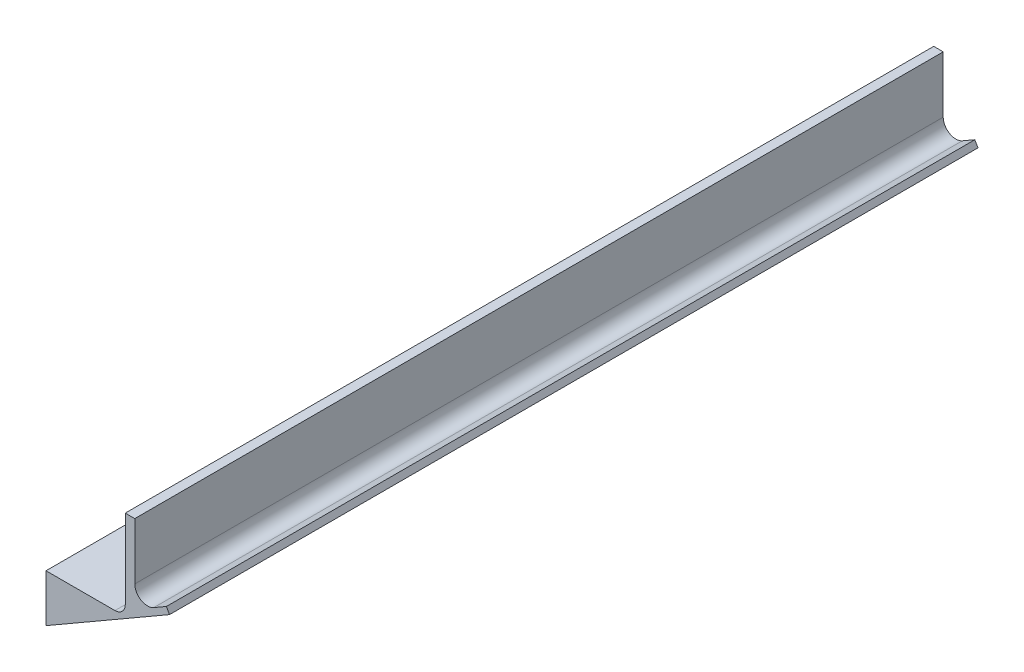
from build123d import *

# Parameters (mm, degrees)
SALIENTE_EXTRUIR1_DEPTH = 255
CROQUIS4_W              = 1.329700855
CROQUIS4_H              = 7.408333333
CROQUIS4_W_2            = 1.329700854
CORTAR_EXTRUIR1_DEPTH   = 1
CROQUIS3_R              = 3.25
CORTAR_EXTRUIR2_DEPTH   = 4


with BuildPart() as part:
    # Croquis2 → Saliente-Extruir1 (new body)
    with BuildSketch(Plane.XY):
        with BuildLine():
            Line((0, 0), (21.75, 0))
            ThreePointArc((21.75, 0), (24.048097039, 0.951902961), (25, 3.25))
            Line((25, 3.25), (25, 28.25))
            Line((25, 28.25), (28, 28.25))
            Line((28, 28.25), (28, 10.403411844))
            ThreePointArc((28, 10.403411844), (30, 6.939310229), (34, 6.939310229))
            Line((34, 6.939310229), (37.97114317, 9.232050808))
            Line((37.97114317, 9.232050808), (38.97114317, 7.5))
            Line((38.97114317, 7.5), (0, -15))
            Line((0, -15), (0, 0))
        make_face()
    extrude(amount=SALIENTE_EXTRUIR1_DEPTH)

    # Croquis4 → Cortar-Extruir1 (cut)
    # profile 1 of 10: a face of its own
    with BuildSketch(Plane.ZY):
        with BuildLine():
            Line((100.85849359, -8), (100.85849359, -0.591666667))
            Line((100.85849359, -0.591666667), (102.045726496, -0.591666667))
            add(Edge.make_bspline(
                [(102.045726496, -0.591666667), (102.128840223, -0.591657181), (102.289663708, -0.591638827), (102.521690027, -0.59978683), (102.736874843, -0.610327184), (102.934533353, -0.622119389), (103.115001988, -0.642439715), (103.278006314, -0.663855118), (103.423872015, -0.689680775), (103.514052852, -0.712847189), (103.556480369, -0.723746327)],
                knots=[0, 0, 0, 0, 1.311965854, 2.538629056, 3.664479157, 4.713267157, 5.663616078, 6.530575999, 7.308677837, 8, 8, 8, 8], degree=3))
            add(Edge.make_bspline(
                [(103.556480369, -0.723746327), (103.612192006, -0.739119756), (103.721516122, -0.769287359), (103.878103145, -0.830212136), (104.026647779, -0.897934346), (104.166968655, -0.975192721), (104.298204147, -1.062919987), (104.419855516, -1.161812373), (104.534546479, -1.267900344), (104.638204624, -1.38414054), (104.731894509, -1.50696984), (104.81329422, -1.636356059), (104.884020136, -1.770320797), (104.940619395, -1.910549911), (104.983265873, -2.056397608), (105.014457329, -2.207241096), (105.034673616, -2.363557681), (105.03658379, -2.469904963), (105.037553419, -2.523888221)],
                knots=[0, 0, 0, 0, 1.099996261, 2.158545794, 3.195537121, 4.207578794, 5.205712374, 6.197378256, 7.190519799, 8.17788031, 9.159561366, 10.129234751, 11.085776129, 12.040971148, 13.00380137, 13.975669004, 14.972423361, 16, 16, 16, 16], degree=3))
            add(Edge.make_bspline(
                [(105.037553419, -2.523888221), (105.035018127, -2.593242538), (105.030027716, -2.729757989), (104.998148633, -2.930274489), (104.938370385, -3.119791401), (104.860152002, -3.301801453), (104.753799454, -3.475625744), (104.618752288, -3.641181627), (104.457197825, -3.803566814), (104.333276633, -3.900905781), (104.268820112, -3.951535791)],
                knots=[0, 0, 0, 0, 0.986156485, 1.941127874, 2.875419072, 3.804401753, 4.751181392, 5.761612777, 6.835722519, 8, 8, 8, 8], degree=3))
            add(Edge.make_bspline(
                [(104.268820112, -3.951535791), (104.321052585, -3.978200015), (104.423466012, -4.030481181), (104.568862991, -4.116415812), (104.703484723, -4.207818191), (104.82793481, -4.302849265), (104.939602769, -4.405537539), (105.043099558, -4.509965974), (105.133319182, -4.622117885), (105.213996289, -4.737995964), (105.28411952, -4.859278139), (105.345189121, -4.985759592), (105.396772422, -5.117872411), (105.440454496, -5.254944249), (105.473032598, -5.397446568), (105.494274213, -5.545430335), (105.510538122, -5.698390847), (105.511803301, -5.802583729), (105.512446581, -5.855560564)],
                knots=[0, 0, 0, 0, 1.164658916, 2.283573913, 3.35186032, 4.395461096, 5.390182219, 6.362969632, 7.312859996, 8.245001507, 9.165155236, 10.092416118, 11.032087915, 11.979892451, 12.947605196, 13.931445124, 14.948243989, 16, 16, 16, 16], degree=3))
            add(Edge.make_bspline(
                [(105.512446581, -5.855560564), (105.508272124, -5.956743289), (105.50003385, -6.156426991), (105.439799611, -6.449608526), (105.33537258, -6.727571212), (105.195148611, -6.989210308), (105.022365701, -7.226951791), (104.823714904, -7.435211265), (104.601196177, -7.611498287), (104.395895756, -7.730478351), (104.218327059, -7.8103251), (104.071250226, -7.859691396), (103.913292824, -7.905424257), (103.741561454, -7.937538817), (103.55916937, -7.966933593), (103.36433824, -7.985082537), (103.157432198, -7.997381629), (103.015320185, -7.999109564), (102.94208734, -8)],
                knots=[0, 0, 0, 0, 1.284142165, 2.534249414, 3.780121997, 5.041676246, 6.291546858, 7.49970053, 8.684500223, 9.883330709, 10.50184324, 11.153274765, 11.851151195, 12.587658647, 13.369265475, 14.195992086, 15.070362669, 16, 16, 16, 16], degree=3))
            Line((102.94208734, -8), (100.85849359, -8))
        make_face()
        with BuildLine():
            Line((102.188194444, -1.921367521), (102.188194444, -3.536004274))
            Line((102.188194444, -3.536004274), (102.541396234, -3.536004274))
            add(Edge.make_bspline(
                [(102.541396234, -3.536004274), (102.589399531, -3.535585667), (102.682066989, -3.534777571), (102.815915304, -3.524369584), (102.940372622, -3.506612912), (103.054966901, -3.481837888), (103.160765631, -3.450377219), (103.257092937, -3.412523259), (103.343525287, -3.366337313), (103.443939687, -3.297541309), (103.550084949, -3.196304908), (103.643523429, -3.050047952), (103.69855807, -2.88185301), (103.704687444, -2.763228913), (103.707852564, -2.701973157)],
                knots=[0, 0, 0, 0, 1.065314748, 2.056525647, 2.977365736, 3.853934255, 4.656397591, 5.425096493, 6.14721249, 6.826394842, 8.123232004, 9.372140726, 10.643011755, 12, 12, 12, 12], degree=3))
            add(Edge.make_bspline(
                [(103.707852564, -2.701973157), (103.705319889, -2.644596964), (103.700423063, -2.533662402), (103.645010256, -2.377900396), (103.558943211, -2.23986338), (103.457328967, -2.145388332), (103.361639411, -2.080864659), (103.279704142, -2.038378568), (103.189774031, -2.000345453), (103.090108128, -1.971264407), (102.98127558, -1.949443014), (102.863805048, -1.933417814), (102.737493853, -1.922510381), (102.650250443, -1.921756646), (102.605210003, -1.921367521)],
                knots=[0, 0, 0, 0, 1.347982417, 2.606269829, 3.849316587, 5.153353503, 5.842674298, 6.568177932, 7.326619318, 8.142485038, 9.012069166, 9.942760135, 10.937925643, 12, 12, 12, 12], degree=3))
            Line((102.605210003, -1.921367521), (102.188194444, -1.921367521))
        make_face(mode=Mode.SUBTRACT)
        with BuildLine():
            Line((102.188194444, -4.770726496), (102.188194444, -6.670299145))
            Line((102.188194444, -6.670299145), (102.571077057, -6.670299145))
            add(Edge.make_bspline(
                [(102.571077057, -6.670299145), (102.646773437, -6.669866695), (102.792309173, -6.669035254), (103.000788857, -6.658989479), (103.19034901, -6.640883739), (103.360487368, -6.618280181), (103.511464532, -6.587655895), (103.642770161, -6.54872104), (103.756204943, -6.505885918), (103.851088717, -6.452979457), (103.928603325, -6.391409456), (103.998552131, -6.328483436), (104.055584029, -6.255892327), (104.100708731, -6.176752263), (104.139764081, -6.093029143), (104.16331951, -6.001453606), (104.181253787, -5.904739734), (104.182240758, -5.83784484), (104.182745726, -5.803619124)],
                knots=[0, 0, 0, 0, 1.753078804, 3.370512758, 4.83203934, 6.162291463, 7.344201807, 8.395507345, 9.331626367, 10.147333109, 10.898971645, 11.62040215, 12.321813352, 13.025280112, 13.727906689, 14.453419512, 15.208716525, 16, 16, 16, 16], degree=3))
            add(Edge.make_bspline(
                [(104.182745726, -5.803619124), (104.181632127, -5.76448148), (104.179463133, -5.688251877), (104.161748941, -5.576834177), (104.129556466, -5.472818362), (104.089008472, -5.373544607), (104.032583786, -5.282567258), (103.965524974, -5.196737933), (103.88450081, -5.118963079), (103.793384411, -5.044538582), (103.687106153, -4.979375903), (103.565616173, -4.922835737), (103.428254471, -4.875615472), (103.274595554, -4.838018666), (103.105313053, -4.806110777), (102.919171389, -4.787058244), (102.717720816, -4.772888039), (102.578031711, -4.771463382), (102.505779247, -4.770726496)],
                knots=[0, 0, 0, 0, 0.845221588, 1.646264278, 2.427170338, 3.19324141, 3.95557735, 4.731569926, 5.540061037, 6.376114724, 7.268642756, 8.224665384, 9.265483498, 10.400594375, 11.639216012, 12.983232105, 14.439614077, 16, 16, 16, 16], degree=3))
            Line((102.505779247, -4.770726496), (102.188194444, -4.770726496))
        make_face(mode=Mode.SUBTRACT)
    # profile 2 of 10: a face of its own
    with BuildSketch(Plane.ZY):
        with Locations((107.317040599, -4.295833334)):
            Rectangle(CROQUIS4_W, CROQUIS4_H)
    # profile 3 of 10: a face of its own
    with BuildSketch(Plane.ZY):
        with BuildLine():
            add(Edge.make_bspline(
                [(113.173066907, -0.401709402), (113.301869861, -0.405044341), (113.556156067, -0.411628266), (113.930119312, -0.466510421), (114.290502045, -0.555933025), (114.637141301, -0.680236913), (114.969169134, -0.842788864), (115.28775672, -1.038980426), (115.591762891, -1.272514595), (115.878072437, -1.537943406), (116.142674094, -1.826585648), (116.371951585, -2.137360338), (116.567471018, -2.462214992), (116.729518047, -2.802020066), (116.852947021, -3.159128874), (116.939562238, -3.531720633), (116.995208223, -3.919689343), (117.001608368, -4.183843154), (117.004861111, -4.31809395)],
                knots=[0, 0, 0, 0, 1.014329547, 2.002516266, 2.970391464, 3.935626869, 4.897733899, 5.877609409, 6.878433252, 7.912639331, 8.949961323, 9.958554974, 10.949718813, 11.932905612, 12.9188844, 13.919928257, 14.942845884, 16, 16, 16, 16], degree=3))
            add(Edge.make_bspline(
                [(117.004861111, -4.31809395), (117.00139708, -4.450832051), (116.994571097, -4.712396736), (116.941833951, -5.096790161), (116.853760123, -5.465390686), (116.732424601, -5.819032645), (116.573316492, -6.156003118), (116.381609901, -6.478453615), (116.152246055, -6.783391718), (115.893590755, -7.070653786), (115.608833716, -7.331405752), (115.307230808, -7.561192972), (114.990174645, -7.755905991), (114.658129297, -7.91545562), (114.31038271, -8.039276211), (113.947793858, -8.126640636), (113.57038518, -8.17973376), (113.313728976, -8.186515157), (113.183455195, -8.189957265)],
                knots=[0, 0, 0, 0, 1.051557043, 2.072126891, 3.067553643, 4.050577992, 5.02905126, 6.015227836, 7.017913613, 8.04756643, 9.074058332, 10.072836633, 11.047628519, 12.017157415, 12.98668631, 13.966869689, 14.968021931, 16, 16, 16, 16], degree=3))
            add(Edge.make_bspline(
                [(113.183455195, -8.189957265), (113.04720444, -8.186869525), (112.779490331, -8.180802538), (112.387689534, -8.12310826), (112.012310516, -8.036200522), (111.656506677, -7.906495387), (111.316654459, -7.744353061), (110.995250856, -7.544665066), (110.69240388, -7.307761401), (110.409850712, -7.039709257), (110.153856858, -6.746401419), (109.927892068, -6.436547699), (109.737285755, -6.112515106), (109.582030946, -5.774151986), (109.45963429, -5.423561183), (109.373297357, -5.058607499), (109.32229607, -4.680166225), (109.315191887, -4.423121347), (109.31159188, -4.292865251)],
                knots=[0, 0, 0, 0, 1.067978421, 2.098431617, 3.099715153, 4.085208694, 5.062210972, 6.048429807, 7.046490867, 8.072918869, 9.098532598, 10.095778865, 11.076610158, 12.041847152, 13.011192615, 13.984257998, 14.978533688, 16, 16, 16, 16], degree=3))
            add(Edge.make_bspline(
                [(109.31159188, -4.292865251), (109.31272177, -4.205235769), (109.314967241, -4.031086394), (109.342016313, -3.77300591), (109.3809592, -3.519962811), (109.438553881, -3.272965982), (109.508516699, -3.030272977), (109.599163412, -2.794142842), (109.702343903, -2.562053058), (109.822900591, -2.336744895), (109.956947972, -2.120291377), (110.103205599, -1.913713554), (110.262041235, -1.719509252), (110.432943218, -1.536402241), (110.616500499, -1.365596098), (110.810298572, -1.204672822), (111.018095991, -1.057907109), (111.235344722, -0.921714647), (111.460819968, -0.798558166), (111.693603838, -0.693731052), (111.928900527, -0.60218732), (112.169853279, -0.529936958), (112.413879859, -0.471089794), (112.663587195, -0.432173155), (112.916719323, -0.405124832), (113.087414924, -0.40285058), (113.173066907, -0.401709402)],
                knots=[0, 0, 0, 0, 1.034744296, 2.056386356, 3.06226378, 4.057406941, 5.050368692, 6.043467995, 7.042652155, 8.049140477, 9.059438543, 10.048523776, 11.036952808, 12.020949711, 13.004946614, 13.997082645, 14.994316842, 16.007702937, 17.024872941, 18.026463647, 19.021641123, 20.005082605, 20.995858141, 21.984425357, 22.988620895, 24, 24, 24, 24], degree=3))
        make_face()
        with BuildLine():
            add(Edge.make_bspline(
                [(113.152290331, -1.731410256), (113.06560596, -1.733736193), (112.894525699, -1.73832666), (112.643582113, -1.773299814), (112.402667408, -1.829155916), (112.17311707, -1.910062797), (111.953936207, -2.013036722), (111.744736281, -2.137717888), (111.548414277, -2.28839207), (111.362352431, -2.456970244), (111.19427617, -2.644805071), (111.045775491, -2.846102034), (110.921504342, -3.060524968), (110.817426476, -3.286081936), (110.73907891, -3.525309267), (110.683274287, -3.776333066), (110.648007849, -4.03958586), (110.643562471, -4.219044948), (110.641292735, -4.310673745)],
                knots=[0, 0, 0, 0, 1.033739768, 2.040188636, 3.016340934, 3.979330865, 4.937572243, 5.900995986, 6.878200029, 7.884839167, 8.891893314, 9.879764717, 10.863503415, 11.843163062, 12.837761627, 13.859916423, 14.907309254, 16, 16, 16, 16], degree=3))
            add(Edge.make_bspline(
                [(110.641292735, -4.310673745), (110.644302058, -4.412219063), (110.650199832, -4.611231063), (110.691697288, -4.901544406), (110.762695305, -5.175716545), (110.86521506, -5.432406545), (110.992366453, -5.674464756), (111.150268304, -5.898924411), (111.336363348, -6.107129469), (111.479729463, -6.228688254), (111.55249399, -6.290384615)],
                knots=[0, 0, 0, 0, 1.078454662, 2.113592447, 3.107694534, 4.079536787, 5.043276885, 6.005368276, 6.987637804, 8, 8, 8, 8], degree=3))
            add(Edge.make_bspline(
                [(111.55249399, -6.290384615), (111.61210203, -6.335963517), (111.72997513, -6.42609442), (111.91812626, -6.541615663), (112.111884876, -6.640628892), (112.312713128, -6.720630409), (112.520186879, -6.783558258), (112.734277676, -6.827625596), (112.954682172, -6.855281661), (113.103730021, -6.858587085), (113.179003072, -6.86025641)],
                knots=[0, 0, 0, 0, 1.023928204, 2.024787132, 3.009472467, 3.9914905, 4.972207045, 5.96565515, 6.972602802, 8, 8, 8, 8], degree=3))
            add(Edge.make_bspline(
                [(113.179003072, -6.86025641), (113.264196903, -6.857910753), (113.431818446, -6.853295597), (113.678090581, -6.818752982), (113.914026768, -6.760294406), (114.141091716, -6.680097269), (114.358630672, -6.575830417), (114.565580464, -6.447282032), (114.762303932, -6.296030524), (114.948128737, -6.125238549), (115.117981393, -5.936663782), (115.266172182, -5.734293123), (115.394394533, -5.522585402), (115.496308098, -5.298544219), (115.577751, -5.064284416), (115.632883984, -4.818768507), (115.668448344, -4.563008603), (115.672894975, -4.38895495), (115.675160256, -4.300285457)],
                knots=[0, 0, 0, 0, 1.026359118, 2.019393844, 2.989460624, 3.950973911, 4.916101784, 5.890408035, 6.881132271, 7.902007068, 8.92769091, 9.933912415, 10.920395702, 11.90457117, 12.894218921, 13.903490204, 14.931958862, 16, 16, 16, 16], degree=3))
            add(Edge.make_bspline(
                [(115.675160256, -4.300285457), (115.672816596, -4.212125837), (115.668203458, -4.038597072), (115.633600046, -3.783494725), (115.575512198, -3.539062697), (115.495074238, -3.304901805), (115.392359222, -3.080782485), (115.265341684, -2.867492873), (115.114467313, -2.665239167), (114.943208474, -2.475399649), (114.756803754, -2.300949292), (114.556679661, -2.149558094), (114.348435893, -2.018003957), (114.127294321, -1.914949757), (113.897779317, -1.832846696), (113.658490368, -1.772384823), (113.408521152, -1.738572348), (113.238461927, -1.733818901), (113.152290331, -1.731410256)],
                knots=[0, 0, 0, 0, 1.055025985, 2.07665775, 3.074803781, 4.057872707, 5.035505728, 6.020516407, 7.023567878, 8.050795229, 9.077271434, 10.074415901, 11.050397877, 12.019801805, 12.988065821, 13.964604439, 14.968634123, 16, 16, 16, 16], degree=3))
        make_face(mode=Mode.SUBTRACT)
    # profile 4 of 10: a face of its own
    with BuildSketch(Plane.ZY):
        with BuildLine():
            Line((118.334561966, -8), (118.334561966, -0.591666667))
            Line((118.334561966, -0.591666667), (119.521794872, -0.591666667))
            add(Edge.make_bspline(
                [(119.521794872, -0.591666667), (119.604908599, -0.591657181), (119.765732084, -0.591638827), (119.997758403, -0.59978683), (120.212943219, -0.610327184), (120.410601729, -0.622119389), (120.591070364, -0.642439715), (120.75407469, -0.663855118), (120.899940391, -0.689680775), (120.990121228, -0.712847189), (121.032548745, -0.723746327)],
                knots=[0, 0, 0, 0, 1.311965854, 2.538629056, 3.664479157, 4.713267157, 5.663616078, 6.530575999, 7.308677837, 8, 8, 8, 8], degree=3))
            add(Edge.make_bspline(
                [(121.032548745, -0.723746327), (121.088260382, -0.739119756), (121.197584498, -0.769287359), (121.354171521, -0.830212136), (121.502716155, -0.897934346), (121.643037031, -0.975192721), (121.774272523, -1.062919987), (121.895923892, -1.161812373), (122.010614856, -1.267900344), (122.114273001, -1.38414054), (122.207962885, -1.50696984), (122.289362596, -1.636356059), (122.360088512, -1.770320797), (122.416687771, -1.910549911), (122.459334249, -2.056397608), (122.490525705, -2.207241096), (122.510741992, -2.363557681), (122.512652166, -2.469904963), (122.513621795, -2.523888221)],
                knots=[0, 0, 0, 0, 1.099996261, 2.158545794, 3.195537121, 4.207578794, 5.205712374, 6.197378256, 7.190519799, 8.17788031, 9.159561366, 10.129234751, 11.085776129, 12.040971148, 13.00380137, 13.975669004, 14.972423361, 16, 16, 16, 16], degree=3))
            add(Edge.make_bspline(
                [(122.513621795, -2.523888221), (122.511086503, -2.593242538), (122.506096092, -2.729757989), (122.474217009, -2.930274489), (122.414438761, -3.119791401), (122.336220378, -3.301801453), (122.22986783, -3.475625744), (122.094820664, -3.641181627), (121.933266201, -3.803566814), (121.809345009, -3.900905781), (121.744888488, -3.951535791)],
                knots=[0, 0, 0, 0, 0.986156485, 1.941127874, 2.875419072, 3.804401753, 4.751181392, 5.761612777, 6.835722519, 8, 8, 8, 8], degree=3))
            add(Edge.make_bspline(
                [(121.744888488, -3.951535791), (121.797120961, -3.978200015), (121.899534388, -4.030481181), (122.044931367, -4.116415812), (122.179553099, -4.207818191), (122.304003186, -4.302849265), (122.415671145, -4.405537539), (122.519167934, -4.509965974), (122.609387558, -4.622117885), (122.690064665, -4.737995964), (122.760187896, -4.859278139), (122.821257497, -4.985759592), (122.872840798, -5.117872411), (122.916522872, -5.254944249), (122.949100974, -5.397446568), (122.97034259, -5.545430335), (122.986606498, -5.698390847), (122.987871677, -5.802583729), (122.988514957, -5.855560564)],
                knots=[0, 0, 0, 0, 1.164658916, 2.283573913, 3.35186032, 4.395461096, 5.390182219, 6.362969632, 7.312859996, 8.245001507, 9.165155236, 10.092416118, 11.032087915, 11.979892451, 12.947605196, 13.931445124, 14.948243989, 16, 16, 16, 16], degree=3))
            add(Edge.make_bspline(
                [(122.988514957, -5.855560564), (122.9843405, -5.956743289), (122.976102226, -6.156426991), (122.915867987, -6.449608526), (122.811440956, -6.727571212), (122.671216987, -6.989210308), (122.498434078, -7.226951791), (122.29978328, -7.435211265), (122.077264553, -7.611498287), (121.871964132, -7.730478351), (121.694395435, -7.8103251), (121.547318602, -7.859691396), (121.3893612, -7.905424257), (121.21762983, -7.937538817), (121.035237747, -7.966933593), (120.840406616, -7.985082537), (120.633500575, -7.997381629), (120.491388561, -7.999109564), (120.418155716, -8)],
                knots=[0, 0, 0, 0, 1.284142165, 2.534249414, 3.780121997, 5.041676246, 6.291546858, 7.49970053, 8.684500223, 9.883330709, 10.50184324, 11.153274765, 11.851151195, 12.587658647, 13.369265475, 14.195992086, 15.070362669, 16, 16, 16, 16], degree=3))
            Line((120.418155716, -8), (118.334561966, -8))
        make_face()
        with BuildLine():
            Line((119.664262821, -1.921367521), (119.664262821, -3.536004274))
            Line((119.664262821, -3.536004274), (120.01746461, -3.536004274))
            add(Edge.make_bspline(
                [(120.01746461, -3.536004274), (120.065467907, -3.535585667), (120.158135365, -3.534777571), (120.29198368, -3.524369584), (120.416440998, -3.506612912), (120.531035277, -3.481837888), (120.636834007, -3.450377219), (120.733161313, -3.412523259), (120.819593663, -3.366337313), (120.920008063, -3.297541309), (121.026153325, -3.196304908), (121.119591805, -3.050047952), (121.174626446, -2.88185301), (121.18075582, -2.763228913), (121.18392094, -2.701973157)],
                knots=[0, 0, 0, 0, 1.065314748, 2.056525647, 2.977365736, 3.853934255, 4.656397591, 5.425096493, 6.14721249, 6.826394842, 8.123232004, 9.372140726, 10.643011755, 12, 12, 12, 12], degree=3))
            add(Edge.make_bspline(
                [(121.18392094, -2.701973157), (121.181388265, -2.644596964), (121.176491439, -2.533662402), (121.121078632, -2.377900396), (121.035011587, -2.23986338), (120.933397343, -2.145388332), (120.837707787, -2.080864659), (120.755772518, -2.038378568), (120.665842407, -2.000345453), (120.566176504, -1.971264407), (120.457343956, -1.949443014), (120.339873424, -1.933417814), (120.21356223, -1.922510381), (120.126318819, -1.921756646), (120.081278379, -1.921367521)],
                knots=[0, 0, 0, 0, 1.347982417, 2.606269829, 3.849316587, 5.153353503, 5.842674298, 6.568177932, 7.326619318, 8.142485038, 9.012069166, 9.942760135, 10.937925643, 12, 12, 12, 12], degree=3))
            Line((120.081278379, -1.921367521), (119.664262821, -1.921367521))
        make_face(mode=Mode.SUBTRACT)
        with BuildLine():
            Line((119.664262821, -4.770726496), (119.664262821, -6.670299145))
            Line((119.664262821, -6.670299145), (120.047145433, -6.670299145))
            add(Edge.make_bspline(
                [(120.047145433, -6.670299145), (120.122841813, -6.669866695), (120.268377549, -6.669035254), (120.476857233, -6.658989479), (120.666417386, -6.640883739), (120.836555744, -6.618280181), (120.987532908, -6.587655895), (121.118838537, -6.54872104), (121.232273319, -6.505885918), (121.327157093, -6.452979457), (121.404671701, -6.391409456), (121.474620507, -6.328483436), (121.531652405, -6.255892327), (121.576777107, -6.176752263), (121.615832457, -6.093029143), (121.639387886, -6.001453606), (121.657322163, -5.904739734), (121.658309134, -5.83784484), (121.658814103, -5.803619124)],
                knots=[0, 0, 0, 0, 1.753078804, 3.370512758, 4.83203934, 6.162291463, 7.344201807, 8.395507345, 9.331626367, 10.147333109, 10.898971645, 11.62040215, 12.321813352, 13.025280112, 13.727906689, 14.453419512, 15.208716525, 16, 16, 16, 16], degree=3))
            add(Edge.make_bspline(
                [(121.658814103, -5.803619124), (121.657700503, -5.76448148), (121.65553151, -5.688251877), (121.637817317, -5.576834177), (121.605624842, -5.472818362), (121.565076849, -5.373544607), (121.508652162, -5.282567258), (121.44159335, -5.196737933), (121.360569186, -5.118963079), (121.269452787, -5.044538582), (121.163174529, -4.979375903), (121.041684549, -4.922835737), (120.904322847, -4.875615472), (120.75066393, -4.838018666), (120.581381429, -4.806110777), (120.395239765, -4.787058244), (120.193789192, -4.772888039), (120.054100087, -4.771463382), (119.981847623, -4.770726496)],
                knots=[0, 0, 0, 0, 0.845221588, 1.646264278, 2.427170338, 3.19324141, 3.95557735, 4.731569926, 5.540061037, 6.376114724, 7.268642756, 8.224665384, 9.265483498, 10.400594375, 11.639216012, 12.983232105, 14.439614077, 16, 16, 16, 16], degree=3))
            Line((119.981847623, -4.770726496), (119.664262821, -4.770726496))
        make_face(mode=Mode.SUBTRACT)
    # profile 5 of 10: a face of its own
    with BuildSketch(Plane.ZY):
        with Locations((124.793108975, -4.295833334)):
            Rectangle(CROQUIS4_W, CROQUIS4_H)
    # profile 6 of 10: a face of its own
    with BuildSketch(Plane.ZY):
        Polygon((126.787660256, -0.591666667), (131.251655983, -0.591666667), (128.598190438, -6.670299145), (131.061698718, -6.670299145), (131.061698718, -8), (126.597702991, -8), (129.252652577, -1.921367521), (126.787660256, -1.921367521), align=None)
    # profile 7 of 10: a face of its own
    with BuildSketch(Plane.ZY):
        Polygon((132.29642094, -0.591666667), (133.626121795, -0.591666667), (133.626121795, -3.199126936), (135.727524038, -0.591666667), (137.405974559, -0.591666667), (134.765865385, -3.868429487), (137.662713675, -8), (136.061433293, -8), (133.626121795, -4.525859709), (133.626121795, -8), (132.29642094, -8), align=None)
    # profile 8 of 10: a face of its own
    with BuildSketch(Plane.ZY):
        Polygon((140.940960537, -0.591666667), (142.174198718, -0.591666667), (145.166025641, -8), (143.745798277, -8), (143.169990318, -6.48034188), (139.942200855, -6.48034188), (139.366392895, -8), (137.947649573, -8), align=None)
        Polygon((141.556837607, -2.578797743), (140.44677484, -5.150641026), (142.666900374, -5.150641026), align=None, mode=Mode.SUBTRACT)
    # profile 9 of 10: a face of its own
    with BuildSketch(Plane.ZY):
        with Locations((146.733173077, -4.295833334)):
            Rectangle(CROQUIS4_W_2, CROQUIS4_H)
    # profile 10 of 10: a face of its own
    with BuildSketch(Plane.ZY):
        Polygon((151.38861011, -0.591666667), (152.621848291, -0.591666667), (155.613675214, -8), (154.19344785, -8), (153.61763989, -6.48034188), (150.389850427, -6.48034188), (149.814042468, -8), (148.395299145, -8), align=None)
        Polygon((152.004487179, -2.578797743), (150.894424412, -5.150641026), (153.114549947, -5.150641026), align=None, mode=Mode.SUBTRACT)
    extrude(amount=-CORTAR_EXTRUIR1_DEPTH, mode=Mode.SUBTRACT)

    # Croquis3 → Cortar-Extruir2 (cut)
    with BuildSketch(Plane(origin=(0, 0, 0), x_dir=(1, 0, 0), z_dir=(0, 1, 0))):
        with Locations((14.45, -199)):
            Circle(CROQUIS3_R)
        with Locations((14.45, -56)):
            Circle(CROQUIS3_R)
    extrude(amount=-CORTAR_EXTRUIR2_DEPTH, mode=Mode.SUBTRACT)


solid = part.part
